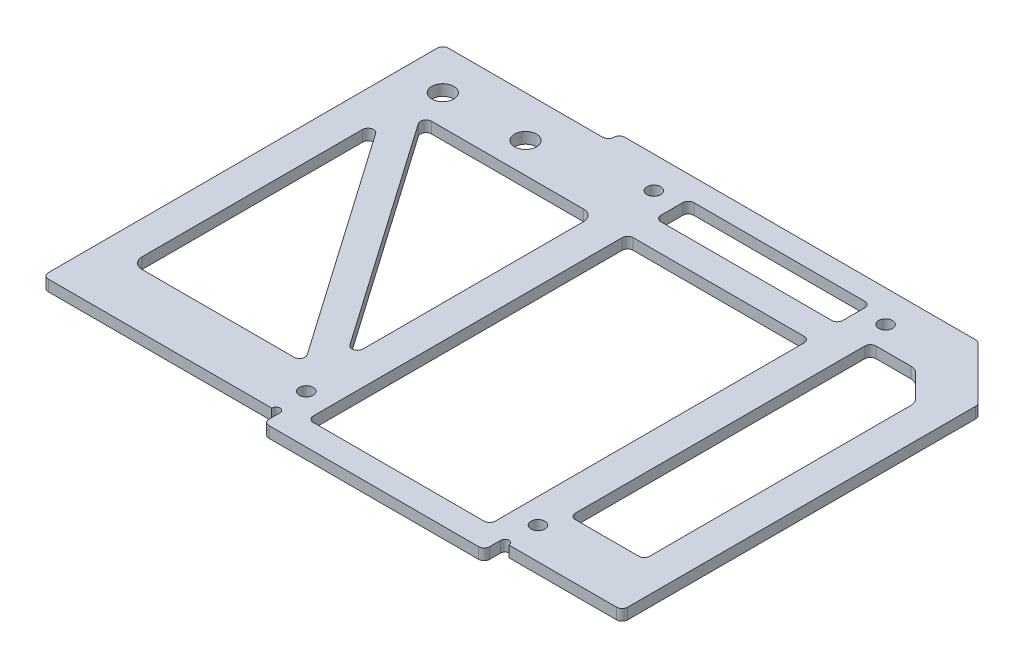
from build123d import *

# Parameters (mm, degrees)
SKETCH_1_R          = 2
SKETCH_1_R_2        = 1.25
EXTRUDE_1_DEPTH     = 2
SKETCH_3_W          = 33
SKETCH_3_H          = 6
SKETCH_3_H_2        = 58
SKETCH_3_W_2        = 34.5
SKETCH_3_H_3        = 49.5
CUT_EXTRUDE_2_DEPTH = 130.341601969
SKETCH_2_R          = 0.75
CUT_EXTRUDE_1_DEPTH = 130.341601969
EXTRUDE_1_2_DEPTH   = 2
FILLET_1_R          = 1
FILLET_2_R          = 2


with BuildPart() as part:
    # 草图1 → Extrude 1 (new body)
    with BuildSketch(Plane(origin=(0, 0, 0), x_dir=(1, 0, 0), z_dir=(0, 1, 0))):
        Polygon((0, 0), (30, 0), (30, 2), (95, 2), (105, -8), (105, -72.5), (83, -72.5), (83, -75.5), (43, -75.5), (43, -72.5), (0, -72.5), align=None)
        with Locations(Location((7.5, -7.5, 0), (0, 0, 270))):
            Circle(SKETCH_1_R, mode=Mode.SUBTRACT)
        with Locations(Location((22.5, -7.5, 0), (0, 0, 270))):
            Circle(SKETCH_1_R, mode=Mode.SUBTRACT)
        with Locations(Location((42, -3.75, 0), (0, 0, 270))):
            Circle(SKETCH_1_R_2, mode=Mode.SUBTRACT)
        with Locations(Location((42, -66.75, 0), (0, 0, 270))):
            Circle(SKETCH_1_R_2, mode=Mode.SUBTRACT)
        with Locations(Location((84, -66.75, 0), (0, 0, 270))):
            Circle(SKETCH_1_R_2, mode=Mode.SUBTRACT)
        with Locations(Location((84, -3.75, 0), (0, 0, 270))):
            Circle(SKETCH_1_R_2, mode=Mode.SUBTRACT)
    extrude(amount=EXTRUDE_1_DEPTH)

    # 草图3 → 切除-拉伸2 (cut, through all)
    with BuildSketch(Plane(origin=(0, 2, 0), x_dir=(1, 0, 0), z_dir=(0, 1, 0))):
        with Locations((63, -5)):
            Rectangle(SKETCH_3_W, SKETCH_3_H)
        with Locations((63, -42)):
            Rectangle(SKETCH_3_W, SKETCH_3_H_2)
        with Locations((23.25, -37.75)):
            Rectangle(SKETCH_3_W_2, SKETCH_3_H_3)
        Polygon((93.686291501, -8), (99, -13.313708499), (99, -62.5), (85.5, -62.5), (85.5, -8), align=None)
    extrude(amount=-CUT_EXTRUDE_2_DEPTH, mode=Mode.SUBTRACT)

    # 草图2 → 切除-拉伸1 (cut, through all)
    with BuildSketch(Plane(origin=(0, 2, 0), x_dir=(1, 0, 0), z_dir=(0, 1, 0))):
        with Locations((42.25, -72.5)):
            Circle(SKETCH_2_R)
        with Locations((83.75, -72.5)):
            Circle(SKETCH_2_R)
    extrude(amount=-CUT_EXTRUDE_1_DEPTH, mode=Mode.SUBTRACT)

    # 草图4 → Extrude 1 2 (add)
    with BuildSketch(Plane(origin=(0, 2, 0), x_dir=(1, 0, 0), z_dir=(0, 1, 0))):
        Polygon((3.949004583, -14.429481654), (38.449004583, -63.929481654), (42.550995417, -61.070518346), (8.050995417, -11.570518346), align=None)
    extrude(amount=-EXTRUDE_1_2_DEPTH)

    # 圆角1
    fillet_1_edges = [part.edges().sort_by_distance(p)[0] for p in [
        (0, 1, 0),
        (83, 1, 75.5),
        (0, 1, 72.5),
        (43, 1, 75.5),
        (105, 1, 72.5),
        (30, 1, -2),
        (30, 1, 0),
        (105, 1, 8),
        (95, 1, -2),
        (46.5, 1, 71),
        (46.5, 1, 13),
        (79.5, 1, 13),
        (79.5, 1, 71),
        (46.5, 1, 8),
        (46.5, 1, 2),
        (79.5, 1, 2),
        (79.5, 1, 8),
        (99, 1, 62.5),
        (85.5, 1, 62.5),
        (85.5, 1, 8),
        (37.452699188, 1, 62.5),
        (40.5, 1, 58.127785791),
        (6, 1, 17.372214209),
        (9.047300812, 1, 13),
    ]]
    fillet(fillet_1_edges, radius=FILLET_1_R - 0.0001)  # a hair under: the kernel refuses the full size

    # 圆角2
    fillet_2_edges = [part.edges().sort_by_distance(p)[0] for p in [
        (93.686291501, 1, 8),
        (99, 1, 13.313708499),
        (6, 1, 62.5),
        (40.5, 1, 13),
    ]]
    fillet(fillet_2_edges, radius=FILLET_2_R)


solid = part.part
